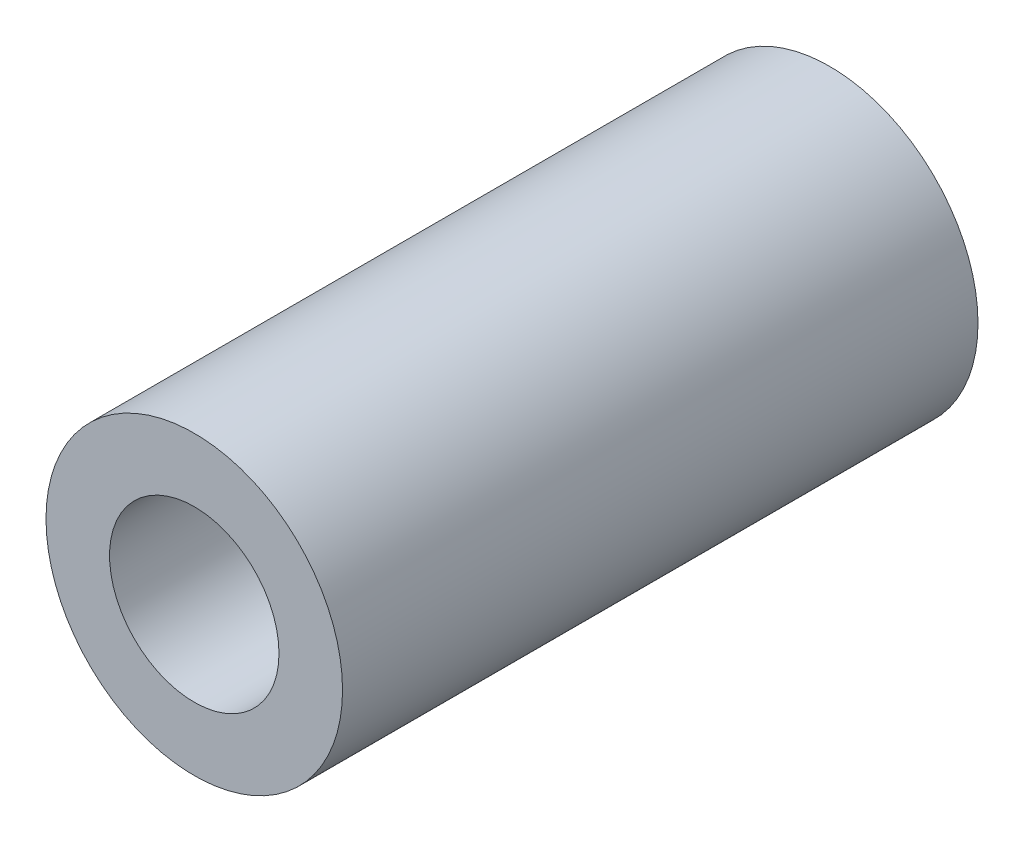
from build123d import *

# Parameters (mm, degrees)
SCHIZZO1_R                   = 3.5
ESTRUSIONE_ESTRUSIONE1_DEPTH = 15
SCHIZZO2_R                   = 2
TAGLIO_ESTRUSIONE1_DEPTH     = 16.795568999
SCHIZZO3_R                   = 2
SCHIZZO3_R_2                 = 1.3
ESTRUSIONE_ESTRUSIONE2_DEPTH = 2
SMUSSO1_SIZE                 = 1.154700538
SMUSSO1_SIZE_2               = 2
SMUSSO2_SIZE                 = 1
SMUSSO2_SIZE2                = 0.577350269


with BuildPart() as part:
    # Schizzo1 → Estrusione-Estrusione1 (new body)
    with BuildSketch(Plane.XY):
        Circle(SCHIZZO1_R)
    extrude(amount=ESTRUSIONE_ESTRUSIONE1_DEPTH)

    # Schizzo2 → Taglio-Estrusione1 (cut, through all)
    with BuildSketch(Plane.XY.offset(15)):
        Circle(SCHIZZO2_R)
    extrude(amount=-TAGLIO_ESTRUSIONE1_DEPTH, mode=Mode.SUBTRACT)

    # Smusso2
    smusso2_edges = [part.edges().sort_by_distance(p)[0] for p in [
        (-2, 0, 0),
    ]]
    smusso2_side = [part.faces().sort_by_distance(p)[0] for p in [
        (-2, 0, 7.5),
    ]]
    chamfer(smusso2_edges, length=SMUSSO2_SIZE, length2=SMUSSO2_SIZE2, reference=smusso2_side[0])


with BuildPart() as body_2:
    # Schizzo3 → Estrusione-Estrusione2 (new body)
    with BuildSketch(Plane(origin=(0, 0, 0), x_dir=(-1, 0, 0), z_dir=(0, 0, -1))):
        Circle(SCHIZZO3_R)
        Circle(SCHIZZO3_R_2, mode=Mode.SUBTRACT)
    extrude(amount=-ESTRUSIONE_ESTRUSIONE2_DEPTH)

    # Smusso1
    # the kernel refuses this chamfer: 2, 1.154700538 mm, written as the material it takes off along each edge
    with BuildSketch(Plane(origin=(0, 0, 0), x_dir=(-1, 0, 0), z_dir=(0, -1, 0))) as smusso1_piece_1:
        Polygon((1.3, -SMUSSO1_SIZE), (1.3 + SMUSSO1_SIZE_2, 0), (1.3, 0), align=None)
    revolve(axis=Axis((0, 0, 0), (0, 0, -1)), mode=Mode.SUBTRACT)


solid = Compound([part.part, body_2.part])
